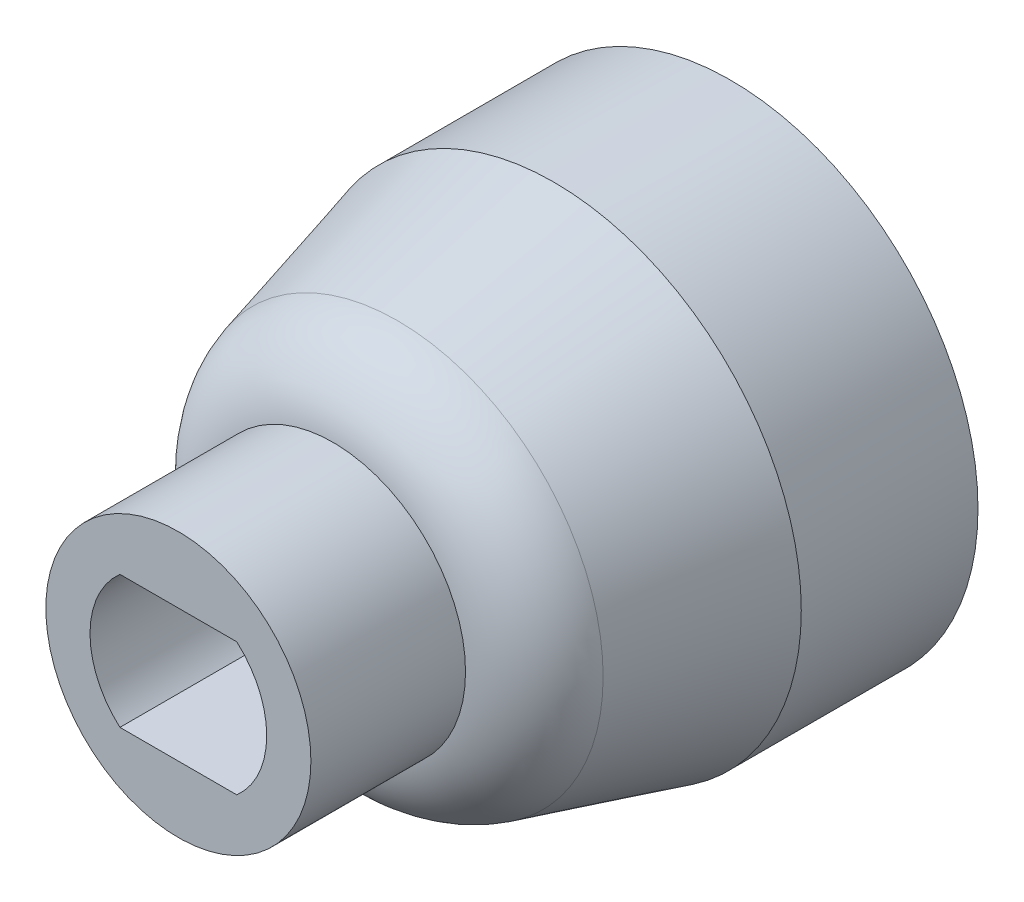
from build123d import *

# Parameters (mm, degrees)
SKETCH1_R           = 5.6
BOSS_EXTRUDE1_DEPTH = 9
SKETCH2_R           = 3
BOSS_EXTRUDE2_DEPTH = 3.5
CHAMFER1_SIZE       = 5
CHAMFER1_SIZE2      = 1.339745962


with BuildPart() as part:
    # Sketch1 → Boss-Extrude1 (new body)
    with BuildSketch(Plane.XY):
        Circle(SKETCH1_R)
    extrude(amount=BOSS_EXTRUDE1_DEPTH)

    # Sketch2 → Boss-Extrude2 (add)
    with BuildSketch(Plane.XY.offset(9)):
        Circle(SKETCH2_R)
        with BuildLine():
            Line((-1.322875656, -1.5), (1.322875656, -1.5))
            ThreePointArc((1.322875656, -1.5), (2, 0), (1.322875656, 1.5))
            Line((1.322875656, 1.5), (-1.322875656, 1.5))
            ThreePointArc((-1.322875656, 1.5), (-2, 0), (-1.322875656, -1.5))
        make_face(mode=Mode.SUBTRACT)
    extrude(amount=BOSS_EXTRUDE2_DEPTH)

    # Chamfer1
    chamfer1_edges = [part.edges().sort_by_distance(p)[0] for p in [
        (-5.6, 0, 9),
    ]]
    chamfer1_side = [part.faces().sort_by_distance(p)[0] for p in [
        (-5.6, 0, 4.5),
    ]]
    chamfer(chamfer1_edges, length=CHAMFER1_SIZE, length2=CHAMFER1_SIZE2, reference=chamfer1_side[0])

    # Fillet1: read off the stored shape, not the designer's step
    # Fillet1 outline → Fillet1 (revolve, cut)
    with BuildSketch(Plane.XZ):
        with BuildLine():
            Line((4.652186603, 7.537287752), (4.652186603, 9))
            Line((4.652186603, 9), (3, 9))
            ThreePointArc((3, 9), (4.04607373, 8.517119759), (4.652186603, 7.537287752))
        make_face()
    revolve(axis=Axis((0, 0, 0), (0, 0, 1)), mode=Mode.SUBTRACT)


solid = part.part
